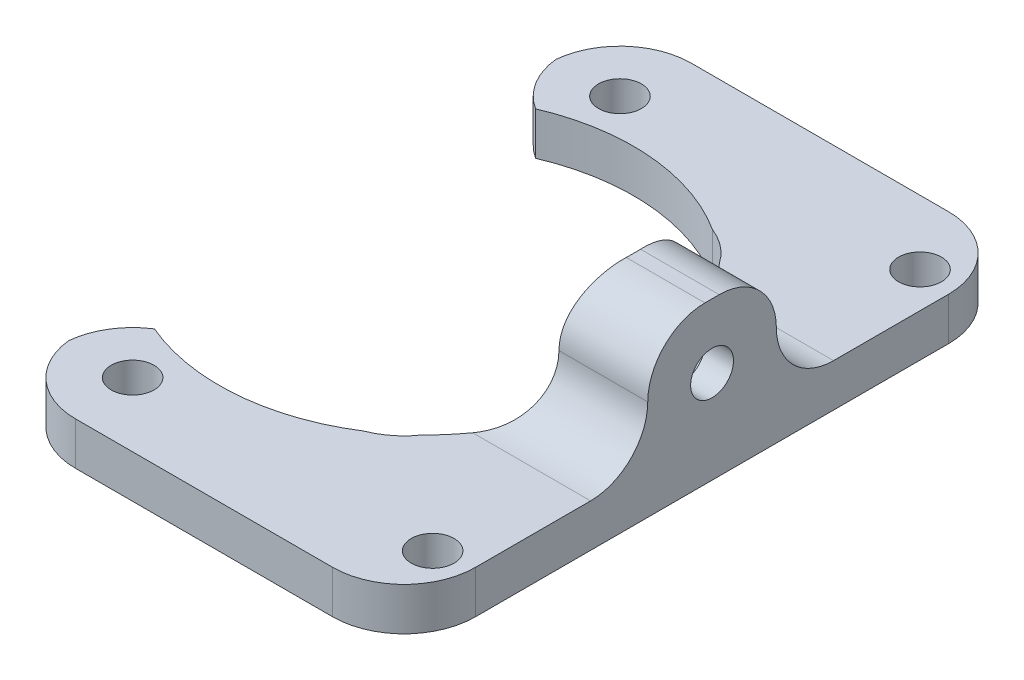
from build123d import *

# Parameters (mm, degrees)
ESQUISSE1_R                  = 1.5
BOSS_EXTRU_1_DEPTH           = 3
ESQUISSE2_W                  = 9
ESQUISSE2_H                  = 9
BOSS_EXTRU_2_DEPTH           = 8
ESQUISSE3_R                  = 1.5
ENL_V_MAT_EXTRU_1_DEPTH      = 32.261930151
ENL_V_MAT_EXTRU_2_DEPTH      = 7
CONG_1_R                     = 5
CONG_2_R                     = 4
CONG_3_R                     = 4
ENL_V_MAT_EXTRU_3_DEPTH      = 44.608458759
ENL_V_MAT_EXTRU_3_DEPTH_BACK = 44.608458759
ESQUISSE5_R                  = 14.5


# Some blends are built 0.0001 mm under size
with BuildPart() as part:
    # Esquisse1 → Boss.-Extru.1 (new body)
    with BuildSketch(Plane(origin=(0, 0, 0), x_dir=(1, 0, 0), z_dir=(0, 1, 0))):
        Polygon((-36.663695412, 22.255522388), (-36.663695412, 13.255522388), (-17.663695412, 13.255522388), (-17.663695412, -11.854477612), (-36.663695412, -11.854477612), (-36.663695412, -20.854477612), (-8.663695412, -20.854477612), (-8.663695412, 22.255522388), align=None)
        with Locations(Location((-32.163695412, 17.755522388, 0), (0, 0, 270))):
            Circle(ESQUISSE1_R, mode=Mode.SUBTRACT)
        with Locations(Location((-11.163695412, 17.755522388, 0), (0, 0, 270))):
            Circle(ESQUISSE1_R, mode=Mode.SUBTRACT)
        with Locations(Location((-32.163695412, -16.354477612, 0), (0, 0, 270))):
            Circle(ESQUISSE1_R, mode=Mode.SUBTRACT)
        with Locations(Location((-11.163695412, -16.354477612, 0), (0, 0, 270))):
            Circle(ESQUISSE1_R, mode=Mode.SUBTRACT)
    extrude(amount=BOSS_EXTRU_1_DEPTH)

    # Esquisse2 → Boss.-Extru.2 (add)
    with BuildSketch(Plane(origin=(0, 3, 0), x_dir=(1, 0, 0), z_dir=(0, 1, 0))):
        with Locations((-13.163695412, 0.700522388)):
            Rectangle(ESQUISSE2_W, ESQUISSE2_H)
    extrude(amount=BOSS_EXTRU_2_DEPTH)

    # Esquisse3 → Enlèv. mat.-Extru.1 (cut, through all)
    with BuildSketch(Plane.ZY.offset(17.663695412)):
        with Locations((-0.700522388, 6.5)):
            Circle(ESQUISSE3_R)
    extrude(amount=-ENL_V_MAT_EXTRU_1_DEPTH, mode=Mode.SUBTRACT)

    # Esquisse4 → Enlèv. mat.-Extru.2 (cut)
    with BuildSketch(Plane.ZY.offset(17.663695412)):
        Polygon((0.786926245, 3.564442716), (2.58546911, 6.320389661), (1.098020477, 9.255946944), (-2.187971021, 9.435557284), (-3.986513886, 6.679610339), (-2.499065254, 3.744053056), align=None)
    extrude(amount=-ENL_V_MAT_EXTRU_2_DEPTH, mode=Mode.SUBTRACT)

    # Congé1
    # the kernel refuses this fillet: 5 mm, written as the material it adds along each edge
    with BuildSketch(Plane(origin=(-17.663695412, 0, 11.854477612), x_dir=(0, 0, -1), z_dir=(0, 1, 0)), Plane(origin=(-17.663695412, 0, -13.255522388), x_dir=(-1, 0, 0), z_dir=(0, 1, 0))) as cong_1_piece_1:
        with BuildLine():
            CenterArc((CONG_1_R, CONG_1_R), CONG_1_R, 180, 90)
            Line((0, CONG_1_R), (0, 0))
            Line((0, 0), (CONG_1_R, 0))
        make_face()
    extrude(amount=3)
    # the kernel refuses this fillet: 5 mm, written as the material it takes off along each edge
    with BuildSketch(Plane(origin=(-8.663695412, -12.5, 20.854477612), x_dir=(0, 0, -1), z_dir=(0, 1, 0)), Plane(origin=(-8.663695412, -12.5, -22.255522388), x_dir=(-1, 0, 0), z_dir=(0, 1, 0)), Plane(origin=(-36.663695412, -12.5, -22.255522388), x_dir=(0, 0, 1), z_dir=(0, 1, 0))) as cong_1_2_piece_1:
        with BuildLine():
            CenterArc((CONG_1_R, CONG_1_R), CONG_1_R, 180, 90)
            Line((0, CONG_1_R), (0, 0))
            Line((0, 0), (CONG_1_R, 0))
        make_face()
    extrude(amount=28, mode=Mode.SUBTRACT)
    with BuildSketch(Plane(origin=(-36.663695412, -12.5, 20.854477612), x_dir=(0, 0, -1), z_dir=(0, 1, 0)), Plane(origin=(-36.663695412, -12.5, 11.854477612), x_dir=(1, 0, 0), z_dir=(0, 1, 0)), Plane(origin=(-36.663695412, -12.5, -13.255522388), x_dir=(0, 0, -1), z_dir=(0, 1, 0))) as cong_1_2_piece_2:
        with BuildLine():
            CenterArc((CONG_1_R, -CONG_1_R), CONG_1_R, 90, 90)
            Line((0, -CONG_1_R), (0, 0))
            Line((0, 0), (CONG_1_R, 0))
        make_face()
    extrude(amount=28, mode=Mode.SUBTRACT)

    # Congé2
    cong_2_edges = [part.edges().sort_by_distance(p)[0] for p in [
        (-13.163695412, 11, 3.799477612),
        (-13.163695412, 11, -5.200522388),
    ]]
    fillet(cong_2_edges, radius=CONG_2_R)

    # Congé3
    cong_3_edges = [part.edges().sort_by_distance(p)[0] for p in [
        (-13.163695412, 3, 3.799477612),
        (-13.163695412, 3, -5.200522388),
    ]]
    fillet(cong_3_edges, radius=CONG_3_R - 0.0001)  # a hair under: the kernel refuses the full size

    # Esquisse5 → Enlèv. mat.-Extru.3 (cut, two sides: drawn at the far end of the back side and taken through both)
    with BuildSketch(Plane(origin=(0, 3, 0), x_dir=(1, 0, 0), z_dir=(0, 1, 0)).offset(-ENL_V_MAT_EXTRU_3_DEPTH_BACK)):
        with Locations((-28.663695412, 0.700522388)):
            Circle(ESQUISSE5_R)
    extrude(amount=ENL_V_MAT_EXTRU_3_DEPTH + ENL_V_MAT_EXTRU_3_DEPTH_BACK, mode=Mode.SUBTRACT)


solid = part.part
